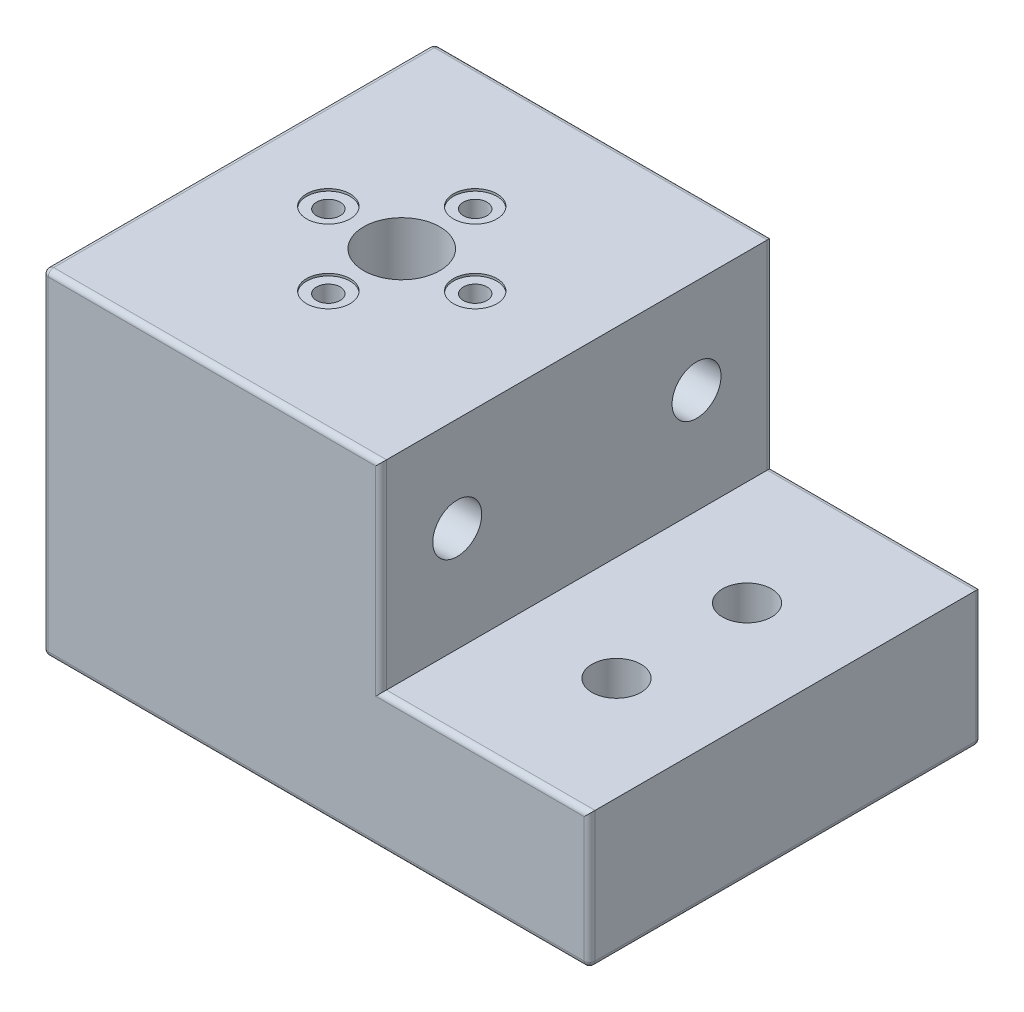
from build123d import *

# Parameters (mm, degrees)
SKETCH1_W               = 62.2
SKETCH1_H               = 72
SKETCH1_R               = 18
SKETCH1_R_2             = 2.175
SKETCH1_R_3             = 7
SKETCH1_R_4             = 9.5
SKETCH1_R_5             = 4
BOSS_EXTRUDE1_DEPTH     = 36.6623
SKETCH1_3_R             = 18
CUT_EXTRUDE1_DEPTH      = 6
SKETCH2_R               = 4.5
CUT_EXTRUDE3_DEPTH      = 81.678152193
BOSS_EXTRUDE2_START     = -25
SKETCH1_6_W             = 62.2
SKETCH1_6_H             = 72
SKETCH1_6_R             = 18
BOSS_EXTRUDE2_DEPTH     = 25
SKETCH2_3_W             = 72
SKETCH2_3_H             = 25.0009
BOSS_EXTRUDE3_DEPTH     = 38.3375
SKETCH1_7_R             = 2.175
CUT_EXTRUDE4_DEPTH      = 88.267766945
CUT_EXTRUDE6_START      = 36.25
SKETCH1_8_R             = 4
SKETCH1_8_R_2           = 2.175
CUT_EXTRUDE6_DEPTH      = 5
CUT_EXTRUDE7_DEPTH      = 5
CUT_EXTRUDE7_DEPTH_BACK = 88.267766945
SKETCH1_9_R             = 4.5
CUT_EXTRUDE8_START      = -22.8864
SKETCH2_4_R             = 6
SKETCH2_4_R_2           = 4.5
CUT_EXTRUDE8_DEPTH      = 58.791752193
CUT_EXTRUDE9_START      = -25.01
SKETCH1_10_R            = 6
CUT_EXTRUDE9_DEPTH      = 2.1136
CHAMFER1_SIZE           = 27
CHAMFER1_SIZE2          = 4.760828479
FILLET1_R               = 1
BOSS_EXTRUDE4_START     = 62.2
SKETCH5_R               = 6
SKETCH5_W               = 40
SKETCH5_H               = 35
SKETCH5_R_2             = 2.5
BOSS_EXTRUDE4_DEPTH     = 15
CUT_EXTRUDE10_START     = 50
SKETCH5_2_R             = 2.5
CUT_EXTRUDE10_DEPTH     = 43.735992157
CHAMFER2_SIZE           = 2
CHAMFER2_SIZE_2         = 14.230739445


with BuildPart() as part:
    # Sketch1 → Boss-Extrude1 (new body)
    # profile 1 of 11: a face of its own
    with BuildSketch(Plane(origin=(0, 0, 0), x_dir=(1, 0, 0), z_dir=(0, 1, 0))):
        with Locations((1.1, 0)):
            Rectangle(SKETCH1_W, SKETCH1_H)
        Circle(SKETCH1_R, mode=Mode.SUBTRACT)
    # profile 2 of 11: a face of its own
    with BuildSketch(Plane(origin=(0, 0, 0), x_dir=(1, 0, 0), z_dir=(0, 1, 0))):
        Circle(SKETCH1_R)
        with Locations((0, -13.5)):
            Circle(SKETCH1_R_2, mode=Mode.SUBTRACT)
        with Locations((13.5, 0)):
            Circle(SKETCH1_R_2, mode=Mode.SUBTRACT)
        with Locations((0, 13.5)):
            Circle(SKETCH1_R_2, mode=Mode.SUBTRACT)
        with Locations((-13.5, 0)):
            Circle(SKETCH1_R_2, mode=Mode.SUBTRACT)
        with Locations(Location((0, 0, 0), (0, 0, 270))):
            Circle(SKETCH1_R_3, mode=Mode.SUBTRACT)
    # profile 3 of 11: a face of its own
    with BuildSketch(Plane(origin=(0, 0, 0), x_dir=(1, 0, 0), z_dir=(0, 1, 0))):
        Circle(SKETCH1_R_4)
        with Locations(Location((0, 0, 0), (0, 0, 270))):
            Circle(SKETCH1_R_3, mode=Mode.SUBTRACT)
    # profile 4 of 11: a face of its own
    with BuildSketch(Plane(origin=(0, 0, 0), x_dir=(1, 0, 0), z_dir=(0, 1, 0))):
        with Locations((-13.5, 0)):
            Circle(SKETCH1_R_5)
        with Locations((-13.5, 0)):
            Circle(SKETCH1_R_2, mode=Mode.SUBTRACT)
    # profile 5 of 11: a face of its own
    with BuildSketch(Plane(origin=(0, 0, 0), x_dir=(1, 0, 0), z_dir=(0, 1, 0))):
        with Locations((-13.5, 0)):
            Circle(SKETCH1_R_2)
    # profile 6 of 11: a face of its own
    with BuildSketch(Plane(origin=(0, 0, 0), x_dir=(1, 0, 0), z_dir=(0, 1, 0))):
        with Locations((0, -13.5)):
            Circle(SKETCH1_R_5)
        with Locations((0, -13.5)):
            Circle(SKETCH1_R_2, mode=Mode.SUBTRACT)
    # profile 7 of 11: a face of its own
    with BuildSketch(Plane(origin=(0, 0, 0), x_dir=(1, 0, 0), z_dir=(0, 1, 0))):
        with Locations((0, -13.5)):
            Circle(SKETCH1_R_2)
    # profile 8 of 11: a face of its own
    with BuildSketch(Plane(origin=(0, 0, 0), x_dir=(1, 0, 0), z_dir=(0, 1, 0))):
        with Locations((13.5, 0)):
            Circle(SKETCH1_R_5)
        with Locations((13.5, 0)):
            Circle(SKETCH1_R_2, mode=Mode.SUBTRACT)
    # profile 9 of 11: a face of its own
    with BuildSketch(Plane(origin=(0, 0, 0), x_dir=(1, 0, 0), z_dir=(0, 1, 0))):
        with Locations((13.5, 0)):
            Circle(SKETCH1_R_2)
    # profile 10 of 11: a face of its own
    with BuildSketch(Plane(origin=(0, 0, 0), x_dir=(1, 0, 0), z_dir=(0, 1, 0))):
        with Locations((0, 13.5)):
            Circle(SKETCH1_R_5)
        with Locations((0, 13.5)):
            Circle(SKETCH1_R_2, mode=Mode.SUBTRACT)
    # profile 11 of 11: a face of its own
    with BuildSketch(Plane(origin=(0, 0, 0), x_dir=(1, 0, 0), z_dir=(0, 1, 0))):
        with Locations((0, 13.5)):
            Circle(SKETCH1_R_2)
    extrude(amount=BOSS_EXTRUDE1_DEPTH)

    # Sketch1<3> → Cut-Extrude1 (cut)
    with BuildSketch(Plane(origin=(0, 0, 0), x_dir=(1, 0, 0), z_dir=(0, 1, 0))):
        with Locations(Location((0, 0, 0), (0, 0, 270))):
            Circle(SKETCH1_3_R)
    extrude(amount=CUT_EXTRUDE1_DEPTH, mode=Mode.SUBTRACT)

    # Sketch2 → Cut-Extrude3 (cut, through all)
    with BuildSketch(Plane(origin=(32.2, 0, 0), x_dir=(0, 0, -1), z_dir=(1, 0, 0))):
        with Locations((-22, 19.25)):
            Circle(SKETCH2_R)
        with Locations((22, 19.25)):
            Circle(SKETCH2_R)
    extrude(amount=-CUT_EXTRUDE3_DEPTH, mode=Mode.SUBTRACT)

    # Sketch1<6> → Boss-Extrude2 (add)
    with BuildSketch(Plane(origin=(0, 0, 0), x_dir=(1, 0, 0), z_dir=(0, 1, 0)).offset(BOSS_EXTRUDE2_START)):
        with Locations((1.1, 0)):
            Rectangle(SKETCH1_6_W, SKETCH1_6_H)
        with Locations(Location((0, 0, 0), (0, 0, 270))):
            Circle(SKETCH1_6_R, mode=Mode.SUBTRACT)
    extrude(amount=BOSS_EXTRUDE2_DEPTH)

    # Sketch2<3> → Boss-Extrude3 (add)
    with BuildSketch(Plane(origin=(32.2, 0, 0), x_dir=(0, 0, -1), z_dir=(1, 0, 0))):
        with Locations((0, -12.50045)):
            Rectangle(SKETCH2_3_W, SKETCH2_3_H)
    extrude(amount=BOSS_EXTRUDE3_DEPTH)

    # Sketch1<7> → Cut-Extrude4 (cut, through all)
    with BuildSketch(Plane(origin=(0, 0, 0), x_dir=(1, 0, 0), z_dir=(0, 1, 0))):
        with Locations(Location((-13.5, 0, 0), (0, 0, 270))):
            Circle(SKETCH1_7_R)
        with Locations(Location((0, -13.5, 0), (0, 0, 270))):
            Circle(SKETCH1_7_R)
        with Locations(Location((13.5, 0, 0), (0, 0, 270))):
            Circle(SKETCH1_7_R)
        with Locations(Location((0, 13.5, 0), (0, 0, 270))):
            Circle(SKETCH1_7_R)
    extrude(amount=CUT_EXTRUDE4_DEPTH, mode=Mode.SUBTRACT)

    # Sketch1<8> → Cut-Extrude6 (cut)
    # profile 1 of 4: a face of its own
    with BuildSketch(Plane(origin=(0, 0, 0), x_dir=(1, 0, 0), z_dir=(0, 1, 0)).offset(CUT_EXTRUDE6_START)):
        with Locations(Location((-13.5, 0, 0), (0, 0, 270))):
            Circle(SKETCH1_8_R)
        with Locations(Location((-13.5, 0, 0), (0, 0, 270))):
            Circle(SKETCH1_8_R_2, mode=Mode.SUBTRACT)
    # profile 2 of 4: a face of its own
    with BuildSketch(Plane(origin=(0, 0, 0), x_dir=(1, 0, 0), z_dir=(0, 1, 0)).offset(CUT_EXTRUDE6_START)):
        with Locations(Location((0, -13.5, 0), (0, 0, 270))):
            Circle(SKETCH1_8_R)
        with Locations(Location((0, -13.5, 0), (0, 0, 270))):
            Circle(SKETCH1_8_R_2, mode=Mode.SUBTRACT)
    # profile 3 of 4: a face of its own
    with BuildSketch(Plane(origin=(0, 0, 0), x_dir=(1, 0, 0), z_dir=(0, 1, 0)).offset(CUT_EXTRUDE6_START)):
        with Locations(Location((13.5, 0, 0), (0, 0, 270))):
            Circle(SKETCH1_8_R)
        with Locations(Location((13.5, 0, 0), (0, 0, 270))):
            Circle(SKETCH1_8_R_2, mode=Mode.SUBTRACT)
    # profile 4 of 4: a face of its own
    with BuildSketch(Plane(origin=(0, 0, 0), x_dir=(1, 0, 0), z_dir=(0, 1, 0)).offset(CUT_EXTRUDE6_START)):
        with Locations(Location((0, 13.5, 0), (0, 0, 270))):
            Circle(SKETCH1_8_R)
        with Locations(Location((0, 13.5, 0), (0, 0, 270))):
            Circle(SKETCH1_8_R_2, mode=Mode.SUBTRACT)
    extrude(amount=CUT_EXTRUDE6_DEPTH, mode=Mode.SUBTRACT)

    # Sketch1<9> → Cut-Extrude7 (cut, two sides: drawn at the far end of the back side and taken through both)
    with BuildSketch(Plane(origin=(0, 0, 0), x_dir=(1, 0, 0), z_dir=(0, 1, 0)).offset(-CUT_EXTRUDE7_DEPTH_BACK)):
        with Locations(Location((51.4831, -12, 0), (0, 0, 270))):
            Circle(SKETCH1_9_R)
        with Locations(Location((51.4831, 12, 0), (0, 0, 270))):
            Circle(SKETCH1_9_R)
    extrude(amount=CUT_EXTRUDE7_DEPTH + CUT_EXTRUDE7_DEPTH_BACK, mode=Mode.SUBTRACT)

    # Sketch2<4> → Cut-Extrude8 (cut, through all)
    # profile 1 of 2: a face of its own
    with BuildSketch(Plane(origin=(32.2, 0, 0), x_dir=(0, 0, -1), z_dir=(1, 0, 0)).offset(CUT_EXTRUDE8_START)):
        with Locations((-22, 19.25)):
            Circle(SKETCH2_4_R)
        with Locations((-22, 19.25)):
            Circle(SKETCH2_4_R_2, mode=Mode.SUBTRACT)
    # profile 2 of 2: a face of its own
    with BuildSketch(Plane(origin=(32.2, 0, 0), x_dir=(0, 0, -1), z_dir=(1, 0, 0)).offset(CUT_EXTRUDE8_START)):
        with Locations((22, 19.25)):
            Circle(SKETCH2_4_R)
        with Locations((22, 19.25)):
            Circle(SKETCH2_4_R_2, mode=Mode.SUBTRACT)
    extrude(amount=-CUT_EXTRUDE8_DEPTH, mode=Mode.SUBTRACT)

    # Sketch1<10> → Cut-Extrude9 (cut)
    with BuildSketch(Plane(origin=(0, 0, 0), x_dir=(1, 0, 0), z_dir=(0, 1, 0)).offset(CUT_EXTRUDE9_START)):
        with Locations(Location((51.4831, 12, 0), (0, 0, 270))):
            Circle(SKETCH1_10_R)
        with Locations(Location((51.4831, -12, 0), (0, 0, 270))):
            Circle(SKETCH1_10_R)
    extrude(amount=CUT_EXTRUDE9_DEPTH, mode=Mode.SUBTRACT)

    # Chamfer1
    chamfer1_edges = [part.edges().sort_by_distance(p)[0] for p in [
        (0, -25, -18),
    ]]
    chamfer1_side = [part.faces().sort_by_distance(p)[0] for p in [
        (0, -9.5, -18),
    ]]
    chamfer(chamfer1_edges, length=CHAMFER1_SIZE, length2=CHAMFER1_SIZE2, reference=chamfer1_side[0])

    # Fillet1
    fillet1_edges = [part.edges().sort_by_distance(p)[0] for p in [
        (32.2, 18.33115, 36),
        (-30, 5.83115, 36),
        (-30, 5.83115, -36),
        (1.1, 36.6623, -36),
        (32.2, 18.33115, -36),
        (-30, 19.25, 28),
        (-30, 19.25, -16),
        (-30, 36.6623, 0),
        (1.1, 36.6623, 36),
        (1.1, -25, 36),
        (-30, -25, 0),
        (1.1, -25, -36),
        (51.36875, 0, -36),
        (32.2, -25.00045, 36),
        (51.36875, 0, 36),
        (51.36875, -25.0009, 36),
        (32.2, -25.00045, -36),
        (51.36875, -25.0009, -36),
        (70.5375, -12.50045, 36),
        (70.5375, -25.0009, 0),
        (70.5375, -12.50045, -36),
    ]]
    fillet(fillet1_edges, radius=FILLET1_R)

    # Sketch5 → Boss-Extrude4 (add)
    # profile 1 of 3: a face of its own
    with BuildSketch(Plane.ZY.offset(-32.2).offset(BOSS_EXTRUDE4_START)):
        with Locations(Location((-22, 19.25, 0), (0, 0, 180))):
            Circle(SKETCH5_R)
    # profile 2 of 3: a face of its own
    with BuildSketch(Plane.ZY.offset(-32.2).offset(BOSS_EXTRUDE4_START)):
        with Locations(Location((22, 19.25, 0), (0, 0, 180))):
            Circle(SKETCH5_R)
    # profile 3 of 3: a face of its own
    with BuildSketch(Plane.ZY.offset(-32.2).offset(BOSS_EXTRUDE4_START)):
        with Locations((0, -7.5009)):
            Rectangle(SKETCH5_W, SKETCH5_H)
        with Locations(Location((-14, -18.0009, 0), (0, 0, 180))):
            Circle(SKETCH5_R_2, mode=Mode.SUBTRACT)
        with Locations(Location((-14, 2.9991, 0), (0, 0, 180))):
            Circle(SKETCH5_R_2, mode=Mode.SUBTRACT)
        with Locations(Location((14, -18.0009, 0), (0, 0, 180))):
            Circle(SKETCH5_R_2, mode=Mode.SUBTRACT)
        with Locations(Location((14, 2.9991, 0), (0, 0, 180))):
            Circle(SKETCH5_R_2, mode=Mode.SUBTRACT)
    extrude(amount=BOSS_EXTRUDE4_DEPTH)


with BuildPart() as boss_extrude4_kept_piece:
    # of the separate pieces the step leaves, the one the design keeps (boss_extrude4_pieces_kept)
    add(part.part.solids().sort_by_distance((32.2, -25, -35))[0])

    # Sketch5<2> → Cut-Extrude10 (cut, through all)
    with BuildSketch(Plane.ZY.offset(-32.2).offset(CUT_EXTRUDE10_START)):
        with Locations(Location((14, 2.9991, 0), (0, 0, 180))):
            Circle(SKETCH5_2_R)
        with Locations(Location((14, -18.0009, 0), (0, 0, 180))):
            Circle(SKETCH5_2_R)
        with Locations(Location((-14, -18.0009, 0), (0, 0, 180))):
            Circle(SKETCH5_2_R)
        with Locations(Location((-14, 2.9991, 0), (0, 0, 180))):
            Circle(SKETCH5_2_R)
    extrude(amount=CUT_EXTRUDE10_DEPTH, mode=Mode.SUBTRACT)

    # Chamfer2
    # the kernel refuses this chamfer: 14.230739445, 2 mm, written as the material it adds along each edge
    with BuildSketch(Plane(origin=(-30, 9.9991, -20), x_dir=(0.2616608511941782, 0, -0.9651598825854388), z_dir=(0, -1, 0))) as chamfer2_piece_1_section:
        Polygon((CHAMFER2_SIZE * 0.965159882585, -CHAMFER2_SIZE * 0.261660851194), (-CHAMFER2_SIZE_2 * 0.26166085119, -CHAMFER2_SIZE_2 * 0.96515988257), (0, 0), align=None)
    chamfer2_piece_1 = extrude(amount=70.985703565, mode=Mode.PRIVATE)
    chamfer2_piece_1 = split(chamfer2_piece_1, bisect_by=Plane(origin=(-30, -7.5009, -20.474187654), z_dir=(-1, 0, 0)), keep=Keep.TOP, mode=Mode.PRIVATE)
    chamfer2_piece_1 = split(chamfer2_piece_1, bisect_by=Plane(origin=(-35.437489827, -25.0009, -20.474187654), z_dir=(0, 1, 0)), keep=Keep.TOP, mode=Mode.PRIVATE)
    add(chamfer2_piece_1)
    with BuildSketch(Plane(origin=(-30, 9.9991, 20), x_dir=(-0.999985663281603, -0.005354739139527592, 0), z_dir=(0, 0, -1))) as chamfer2_piece_2:
        Polygon((CHAMFER2_SIZE_2 * 0.999985663265, CHAMFER2_SIZE_2 * 0.00535473913944), (-CHAMFER2_SIZE * 0.00535473913953, CHAMFER2_SIZE * 0.999985663282), (0, 0), align=None)
    extrude(amount=40)
    with BuildSketch(Plane(origin=(-30, -60.986603565, 20), x_dir=(0.2616608511941782, 0, 0.9651598825854388), z_dir=(0, 1, 0))) as chamfer2_piece_3_section:
        Polygon((CHAMFER2_SIZE * 0.965159882585, -CHAMFER2_SIZE * 0.261660851194), (-CHAMFER2_SIZE_2 * 0.26166085119, -CHAMFER2_SIZE_2 * 0.96515988257), (0, 0), align=None)
    chamfer2_piece_3 = extrude(amount=70.985703565, mode=Mode.PRIVATE)
    chamfer2_piece_3 = split(chamfer2_piece_3, bisect_by=Plane(origin=(-35.437489827, -25.0009, 20.474187654), z_dir=(0, 1, 0)), keep=Keep.TOP, mode=Mode.PRIVATE)
    chamfer2_piece_3 = split(chamfer2_piece_3, bisect_by=Plane(origin=(-30, -7.5009, 20.474187654), z_dir=(-1, 0, 0)), keep=Keep.TOP, mode=Mode.PRIVATE)
    add(chamfer2_piece_3)
    with BuildSketch(Plane(origin=(-30, 9.9991, 20), x_dir=(-0.999985663281603, -0.005354739139527592, 0), z_dir=(0, 0, -1))) as chamfer2_piece_4a_section:
        Polygon((CHAMFER2_SIZE_2 * 0.999985663265, CHAMFER2_SIZE_2 * 0.00535473913944), (-CHAMFER2_SIZE * 0.00535473913953, CHAMFER2_SIZE * 0.999985663282), (0, 0), align=None)
    chamfer2_piece_4a = extrude(amount=76.986603565, mode=Mode.PRIVATE)
    chamfer2_piece_4a = split(chamfer2_piece_4a, bisect_by=Plane(origin=(-35.204659453, 10.502886418, -20), z_dir=(0, 0, -1)), keep=Keep.TOP, mode=Mode.PRIVATE)
    with BuildSketch(Plane(origin=(-30, 46.985703565, -20), x_dir=(0.2616608511941782, 0, -0.9651598825854388), z_dir=(0, -1, 0))) as chamfer2_piece_4b_section:
        Polygon((CHAMFER2_SIZE * 0.965159882585, -CHAMFER2_SIZE * 0.261660851194), (-CHAMFER2_SIZE_2 * 0.26166085119, -CHAMFER2_SIZE_2 * 0.96515988257), (0, 0), align=None)
    chamfer2_piece_4b = extrude(amount=107.97230713, mode=Mode.PRIVATE)
    chamfer2_piece_4b = split(chamfer2_piece_4b, bisect_by=Plane(origin=(-35.437489827, 9.9991, -20.474187654), z_dir=(0, 1, 0)), keep=Keep.TOP, mode=Mode.PRIVATE)
    chamfer2_piece_4b = split(chamfer2_piece_4b, bisect_by=Plane(origin=(-30, 28.492401783, -20.474187654), z_dir=(-1, 0, 0)), keep=Keep.TOP, mode=Mode.PRIVATE)
    chamfer2_piece_4 = chamfer2_piece_4a & chamfer2_piece_4b
    add(chamfer2_piece_4)
    with BuildSketch(Plane(origin=(-30, 9.9991, 56.986603565), x_dir=(-0.999985663281603, -0.005354739139527589, 0), z_dir=(0, 0, -1))) as chamfer2_piece_5a_section:
        Polygon((CHAMFER2_SIZE_2 * 0.999985663265, CHAMFER2_SIZE_2 * 0.00535473913944), (-CHAMFER2_SIZE * 0.00535473913953, CHAMFER2_SIZE * 0.999985663282), (0, 0), align=None)
    chamfer2_piece_5a = extrude(amount=76.986603565, mode=Mode.PRIVATE)
    chamfer2_piece_5a = split(chamfer2_piece_5a, bisect_by=Plane(origin=(-35.204659453, 10.502886418, 20), z_dir=(0, 0, 1)), keep=Keep.TOP, mode=Mode.PRIVATE)
    with BuildSketch(Plane(origin=(-30, -60.986603565, 20), x_dir=(0.2616608511941782, 0, 0.9651598825854388), z_dir=(0, 1, 0))) as chamfer2_piece_5b_section:
        Polygon((CHAMFER2_SIZE * 0.965159882585, -CHAMFER2_SIZE * 0.261660851194), (-CHAMFER2_SIZE_2 * 0.26166085119, -CHAMFER2_SIZE_2 * 0.96515988257), (0, 0), align=None)
    chamfer2_piece_5b = extrude(amount=107.97230713, mode=Mode.PRIVATE)
    chamfer2_piece_5b = split(chamfer2_piece_5b, bisect_by=Plane(origin=(-35.437489827, 9.9991, 20.474187654), z_dir=(0, 1, 0)), keep=Keep.TOP, mode=Mode.PRIVATE)
    chamfer2_piece_5b = split(chamfer2_piece_5b, bisect_by=Plane(origin=(-30, 28.492401783, 20.474187654), z_dir=(-1, 0, 0)), keep=Keep.TOP, mode=Mode.PRIVATE)
    chamfer2_piece_5 = chamfer2_piece_5a & chamfer2_piece_5b
    add(chamfer2_piece_5)


solid = boss_extrude4_kept_piece.part
